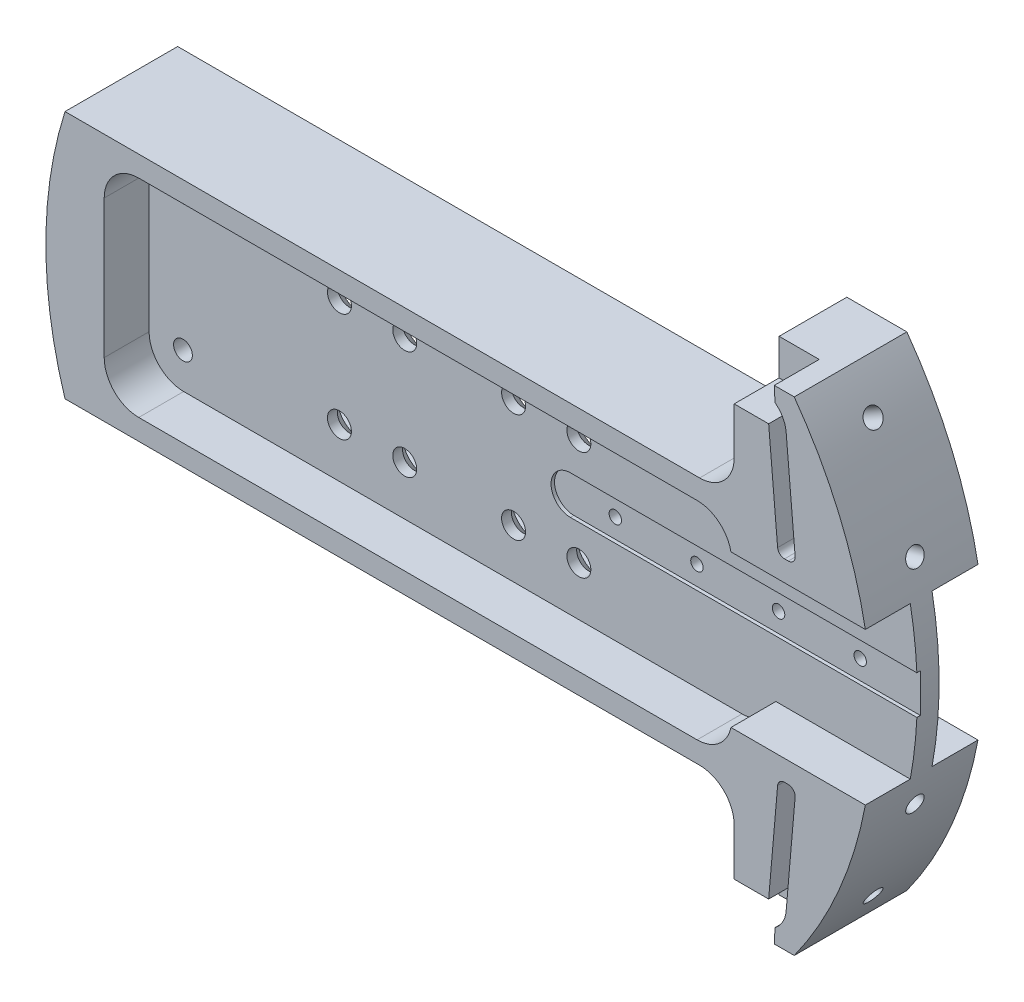
from build123d import *

# Parameters (mm, degrees)
BOSS_EXTRUDE1_DEPTH  = 2.54
BOSS_EXTRUDE2_DEPTH  = 8.255
SKETCH3_W            = 64.77
SKETCH3_H            = 7.1
CUT_EXTRUDE1_DEPTH   = 0.635
SKETCH4_R            = 1.143
CUT_EXTRUDE2_DEPTH   = 11.43
BOSS_EXTRUDE5_DEPTH  = 8.255
BOSS_EXTRUDE6_DEPTH  = 8.255
BOSS_EXTRUDE7_START  = -8.255
BOSS_EXTRUDE7_DEPTH  = 8.255
SKETCH39_W           = 13.975397925
SKETCH39_H           = 27.94
CUT_EXTRUDE19_DEPTH  = 8.255
FILLET2_R            = 1.27
SKETCH45_W           = 121.797556925
SKETCH45_H           = 2.54
BOSS_EXTRUDE8_DEPTH  = 10.795
SKETCH46_W           = 115.173424181
SKETCH46_H           = 40.351825118
CUT_EXTRUDE20_DEPTH  = 8.255
SKETCH48_W           = 115.173424181
SKETCH48_H           = 6.205912559
BOSS_EXTRUDE9_DEPTH  = 2.54
CUT_EXTRUDE24_DEPTH  = 43.688
CUT_EXTRUDE25_DEPTH  = 0.635
SKETCH53_W           = 13.339244652
SKETCH53_H           = 4.785328469
CUT_EXTRUDE26_DEPTH  = 43.688
BOSS_EXTRUDE10_REACH = 90.657
FILLET8_R            = 6.35
BOSS_EXTRUDE13_START = -20.701
BOSS_EXTRUDE13_DEPTH = 9.906
SKETCH63_R           = 1.651
CUT_EXTRUDE30_DEPTH  = 7.62
SKETCH64_R           = 1.651
CUT_EXTRUDE31_DEPTH  = 10.16
SKETCH65_R           = 1.651
CUT_EXTRUDE32_DEPTH  = 10.16
SKETCH66_R           = 1.651
CUT_EXTRUDE33_DEPTH  = 8.89
SKETCH67_R           = 1.651
CUT_EXTRUDE34_DEPTH  = 8.89
MOVE_FACE1_BY        = 1.460000128
SKETCH69_R           = 2.2
CUT_EXTRUDE35_DEPTH  = 4
CHAMFER1_SIZE        = 2.2
SKETCH70_R           = 1.725
CUT_EXTRUDE36_DEPTH  = 10


with BuildPart() as part:
    # Sketch1 → Boss-Extrude1 (new body)
    with BuildSketch(Plane.XY):
        with BuildLine():
            Line((-71.572584947, 25.4), (-65.222584947, 25.4))
            Line((-65.222584947, 25.4), (-65.222584947, 22.86))
            ThreePointArc((-65.222584947, 22.86), (-63.362713008, 18.369871939), (-58.872584947, 16.51))
            Line((-58.872584947, 16.51), (44.196, 16.51))
            ThreePointArc((44.196, 16.51), (48.686128061, 18.369871939), (50.546, 22.86))
            Line((50.546, 22.86), (50.546, 44.45))
            Line((50.546, 44.45), (61.579155694, 44.45))
            ThreePointArc((61.579155694, 44.45), (75.946, 0), (61.579155694, -44.45))
            Line((61.579155694, -44.45), (50.546, -44.45))
            Line((50.546, -44.45), (50.546, -22.86))
            ThreePointArc((50.546, -22.86), (48.686128061, -18.369871939), (44.196, -16.51))
            Line((44.196, -16.51), (-58.872584947, -16.51))
            ThreePointArc((-58.872584947, -16.51), (-63.362713008, -18.369871939), (-65.222584947, -22.86))
            Line((-65.222584947, -22.86), (-65.222584947, -25.4))
            Line((-65.222584947, -25.4), (-71.572584947, -25.4))
            ThreePointArc((-71.572584947, -25.4), (-75.946, 0), (-71.572584947, 25.4))
        make_face()
    extrude(amount=BOSS_EXTRUDE1_DEPTH)

    # Sketch2 → Boss-Extrude2 (add)
    with BuildSketch(Plane.XY.offset(2.54)):
        with BuildLine():
            Line((61.865268471, 17.78), (60.095110466, 38.1))
            ThreePointArc((60.095110466, 38.1), (59.464196764, 40.158289632), (58.047089349, 41.778911391))
            Line((58.047089349, 41.778911391), (57.900800643, 44.704))
            Line((57.900800643, 44.704), (61.395010384, 44.704))
            ThreePointArc((61.395010384, 44.704), (69.822038137, 29.877715884), (74.728381149, 13.544887112))
            Line((74.728381149, 13.544887112), (60.759450402, 13.544887112))
            Line((60.759450402, 13.544887112), (60.759450402, 15.094127876))
            ThreePointArc((60.759450402, 15.094127876), (61.639191639, 16.302501703), (61.865268471, 17.78))
        make_face()
        with BuildLine():
            Line((58.651639318, 17.500047669), (56.881481313, 37.820047669))
            Line((56.881481313, 37.820047669), (50.546, 37.820047669))
            Line((50.546, 37.820047669), (50.546, 16.566735288))
            Line((50.546, 16.566735288), (57.366094516, 16.566735288))
            ThreePointArc((57.366094516, 16.566735288), (58.160401987, 16.824667019), (58.651639318, 17.500047669))
        make_face()
        with BuildLine():
            Line((60.759450402, -13.544887112), (74.728381149, -13.544887112))
            ThreePointArc((74.728381149, -13.544887112), (69.822038137, -29.877715884), (61.395010384, -44.704))
            Line((61.395010384, -44.704), (57.900800643, -44.704))
            Line((57.900800643, -44.704), (58.047089349, -41.778911391))
            ThreePointArc((58.047089349, -41.778911391), (59.464196764, -40.158289632), (60.095110466, -38.1))
            Line((60.095110466, -38.1), (61.865268471, -17.78))
            ThreePointArc((61.865268471, -17.78), (61.639191639, -16.302501703), (60.759450402, -15.094127876))
            Line((60.759450402, -15.094127876), (60.759450402, -13.544887112))
        make_face()
        with BuildLine():
            Line((50.546, -16.566735288), (57.366094516, -16.566735288))
            ThreePointArc((57.366094516, -16.566735288), (58.160401987, -16.824667019), (58.651639318, -17.500047669))
            Line((58.651639318, -17.500047669), (56.881481313, -37.820047669))
            Line((56.881481313, -37.820047669), (50.546, -37.820047669))
            Line((50.546, -37.820047669), (50.546, -16.566735288))
        make_face()
    extrude(amount=BOSS_EXTRUDE2_DEPTH)

    # Sketch3 → Cut-Extrude1 (cut)
    with BuildSketch(Plane.XY.offset(2.54)):
        with Locations((44.577, 0)):
            Rectangle(SKETCH3_W, SKETCH3_H)
    extrude(amount=-CUT_EXTRUDE1_DEPTH, mode=Mode.SUBTRACT)

    # Sketch4 → Cut-Extrude2 (cut)
    with BuildSketch(Plane.XY.offset(1.905)):
        with Locations((19.812, 0)):
            Circle(SKETCH4_R)
        with Locations((34.812, 0)):
            Circle(SKETCH4_R)
        with Locations((49.812, 0)):
            Circle(SKETCH4_R)
        with Locations((64.812, 0)):
            Circle(SKETCH4_R)
    extrude(amount=-CUT_EXTRUDE2_DEPTH, mode=Mode.SUBTRACT)

    # Sketch19 → Boss-Extrude5 (add)
    with BuildSketch(Plane.XY.offset(2.54)):
        with BuildLine():
            Line((-71.572584947, -25.4), (-65.222584947, -25.4))
            Line((-65.222584947, -25.4), (-65.222584947, 25.4))
            Line((-65.222584947, 25.4), (-71.572584947, 25.4))
            ThreePointArc((-71.572584947, 25.4), (-75.946, 0), (-71.572584947, -25.4))
        make_face()
    extrude(amount=BOSS_EXTRUDE5_DEPTH)

    # Sketch33 → Boss-Extrude6 (add)
    with BuildSketch(Plane.XY.offset(2.54)):
        with BuildLine():
            Line((12.137284041, 16.51), (-58.872584947, 16.51))
            ThreePointArc((-58.872584947, 16.51), (-63.362713008, 18.369871939), (-65.222584947, 22.86))
            Line((-65.222584947, 22.86), (-65.222584947, 7.62))
            ThreePointArc((-65.222584947, 7.62), (-63.362713008, 12.110128061), (-58.872584947, 13.97))
            Line((-58.872584947, 13.97), (12.137284041, 13.97))
            Line((12.137284041, 13.97), (12.137284041, 16.51))
        make_face()
        with BuildLine():
            Line((12.137284041, -13.97), (12.137284041, -16.51))
            Line((12.137284041, -16.51), (-58.872584947, -16.51))
            ThreePointArc((-58.872584947, -16.51), (-63.362713008, -18.369871939), (-65.222584947, -22.86))
            Line((-65.222584947, -22.86), (-65.222584947, -7.62))
            ThreePointArc((-65.222584947, -7.62), (-63.362713008, -12.110128061), (-58.872584947, -13.97))
            Line((-58.872584947, -13.97), (12.137284041, -13.97))
        make_face()
    extrude(amount=BOSS_EXTRUDE6_DEPTH)

    # Sketch38 → Boss-Extrude7 (add)
    with BuildSketch(Plane.XY.offset(10.795).offset(BOSS_EXTRUDE7_START)):
        with BuildLine():
            Line((12.137284041, -13.97), (60.759450402, -13.97))
            Line((60.759450402, -13.97), (60.759450402, -15.094127876))
            ThreePointArc((60.759450402, -15.094127876), (61.639191639, -16.302501703), (61.865268471, -17.78))
            Line((61.865268471, -17.78), (58.298191457, -17.78))
            Line((58.298191457, -17.78), (50.546, -22.86))
            ThreePointArc((50.546, -22.86), (48.686128061, -18.369871939), (44.196, -16.51))
            Line((44.196, -16.51), (12.137284041, -16.51))
            Line((12.137284041, -16.51), (12.137284041, -13.97))
        make_face()
        with BuildLine():
            Line((61.865268471, 17.78), (58.298191457, 17.78))
            Line((58.298191457, 17.78), (50.546, 22.86))
            ThreePointArc((50.546, 22.86), (48.686128061, 18.369871939), (44.196, 16.51))
            Line((44.196, 16.51), (12.137284041, 16.51))
            Line((12.137284041, 16.51), (12.137284041, 13.97))
            Line((12.137284041, 13.97), (60.759450402, 13.97))
            Line((60.759450402, 13.97), (60.759450402, 15.094127876))
            ThreePointArc((60.759450402, 15.094127876), (61.639191639, 16.302501703), (61.865268471, 17.78))
        make_face()
    extrude(amount=BOSS_EXTRUDE7_DEPTH)

    # Sketch39 → Cut-Extrude19 (cut)
    with BuildSketch(Plane.XY.offset(10.795)):
        with Locations((67.747149365, 0)):
            Rectangle(SKETCH39_W, SKETCH39_H)
    extrude(amount=-CUT_EXTRUDE19_DEPTH, mode=Mode.SUBTRACT)

    # Fillet2
    fillet2_edges = [part.edges().sort_by_distance(p)[0] for p in [
        (58.627251529, -17.78, 6.6675),
        (58.627251529, 17.78, 6.6675),
        (61.865268471, 17.78, 6.6675),
        (61.865268471, -17.78, 6.6675),
    ]]
    fillet(fillet2_edges, radius=FILLET2_R)

    # Sketch45 → Boss-Extrude8 (add)
    with BuildSketch(Plane.XY.offset(10.795)):
        with Locations((-6.822240568, -21.445912559)):
            Rectangle(SKETCH45_W, SKETCH45_H)
        with Locations((-6.822240568, 21.445912559)):
            Rectangle(SKETCH45_W, SKETCH45_H)
    extrude(amount=-BOSS_EXTRUDE8_DEPTH)

    # Sketch46 → Cut-Extrude20 (cut)
    with BuildSketch(Plane.XY.offset(10.795)):
        with Locations((-7.635872857, 0)):
            Rectangle(SKETCH46_W, SKETCH46_H)
    extrude(amount=-CUT_EXTRUDE20_DEPTH, mode=Mode.SUBTRACT)

    # Sketch48 → Boss-Extrude9 (add)
    with BuildSketch(Plane.XY.offset(2.54)):
        with Locations((-7.635872857, 17.07295628)):
            Rectangle(SKETCH48_W, SKETCH48_H)
        with Locations((-7.635872857, -17.07295628)):
            Rectangle(SKETCH48_W, SKETCH48_H)
    extrude(amount=-BOSS_EXTRUDE9_DEPTH)

    # Sketch51 → Cut-Extrude24 (cut)
    with BuildSketch(Plane.XY.offset(10.795)):
        Polygon((-80.776388958, 25.4), (-80.776388958, 22.715912559), (-65.222584947, 22.715912559), (50.546, 22.715912559), (50.546, 25.4), (-65.222584947, 25.4), align=None)
        Polygon((50.546, -22.715912559), (-65.222584947, -22.715912559), (-80.776388958, -22.715912559), (-80.776388958, -25.4), (-65.222584947, -25.4), (50.546, -25.4), align=None)
    extrude(amount=-CUT_EXTRUDE24_DEPTH, mode=Mode.SUBTRACT)

    # Sketch52 → Cut-Extrude25 (cut)
    with BuildSketch(Plane.XY.offset(2.54)):
        with BuildLine():
            Line((12.192, -3.55), (12.192, 3.55))
            ThreePointArc((12.192, 3.55), (8.642, 0), (12.192, -3.55))
        make_face()
    extrude(amount=-CUT_EXTRUDE25_DEPTH, mode=Mode.SUBTRACT)

    # Sketch53 → Cut-Extrude26 (cut)
    with BuildSketch(Plane(origin=(0, 0, 0), x_dir=(-1, 0, 0), z_dir=(0, 0, -1))):
        with Locations((-57.215622326, -46.842664235)):
            Rectangle(SKETCH53_W, SKETCH53_H)
        with Locations((-57.215622326, 46.842664235)):
            Rectangle(SKETCH53_W, SKETCH53_H)
    extrude(amount=-CUT_EXTRUDE26_DEPTH, mode=Mode.SUBTRACT)

    # Boss-Extrude10: up to this face of the body (flat: up to its plane)
    boss_extrude10_end = Plane(part.part.faces().sort_by_distance((5.813884526, 0, 0))[0])
    # Sketch58 → Boss-Extrude10 (add, up to the picked face)
    with BuildSketch(Plane.XY.offset(10.795), mode=Mode.PRIVATE) as boss_extrude10_sk1:
        with BuildLine():
            Line((50.546, 22.86), (-72.423858748, 22.86))
            ThreePointArc((-72.423858748, 22.86), (-72.446555826, 22.787967547), (-72.469181261, 22.715912559))
            Line((-72.469181261, 22.715912559), (-65.222584947, 22.715912559))
            Line((-65.222584947, 22.715912559), (-65.222584947, 19.05))
            Line((-65.222584947, 19.05), (50.546, 19.05))
            Line((50.546, 19.05), (50.546, 22.86))
        make_face()
    boss_extrude10_tool1 = split(extrude(boss_extrude10_sk1.sketch, amount=-BOSS_EXTRUDE10_REACH, mode=Mode.PRIVATE), bisect_by=boss_extrude10_end, keep=Keep.BOTH, mode=Mode.PRIVATE)
    # Sketch58 → Boss-Extrude10 (add, up to the picked face)
    with BuildSketch(Plane.XY.offset(10.795), mode=Mode.PRIVATE) as boss_extrude10_sk2:
        with BuildLine():
            Line((-65.222584947, -22.715912559), (-65.222584947, -19.05))
            Line((-65.222584947, -19.05), (50.546, -19.05))
            Line((50.546, -19.05), (50.546, -22.86))
            Line((50.546, -22.86), (-72.423858748, -22.86))
            ThreePointArc((-72.423858748, -22.86), (-72.446555826, -22.787967547), (-72.469181261, -22.715912559))
            Line((-72.469181261, -22.715912559), (-65.222584947, -22.715912559))
        make_face()
    boss_extrude10_tool2 = split(extrude(boss_extrude10_sk2.sketch, amount=-BOSS_EXTRUDE10_REACH, mode=Mode.PRIVATE), bisect_by=boss_extrude10_end, keep=Keep.BOTH, mode=Mode.PRIVATE)
    add(boss_extrude10_tool1.solids().sort_by(Axis((-7.483073, 20.959315, 10.795), (0, 0, -1)))[0])
    add(boss_extrude10_tool2.solids().sort_by(Axis((-7.483073, -20.959315, 10.795), (0, 0, -1)))[0])

    # Fillet8
    # the kernel refuses this fillet: 6.35 mm, written as the material it adds along each edge
    with BuildSketch(Plane(origin=(50.546, 22.86, 10.795), x_dir=(-1, 0, 0), z_dir=(0, 0, -1))) as fillet8_piece_1:
        with BuildLine():
            CenterArc((FILLET8_R, FILLET8_R), FILLET8_R, 180, 90)
            Line((0, FILLET8_R), (-FILLET8_R * 0.02, FILLET8_R))
            Line((-FILLET8_R * 0.02, FILLET8_R), (-FILLET8_R * 0.02, -FILLET8_R * 0.02))
            Line((-FILLET8_R * 0.02, -FILLET8_R * 0.02), (FILLET8_R, -FILLET8_R * 0.02))
            Line((FILLET8_R, -FILLET8_R * 0.02), (FILLET8_R, 0))
        make_face()
    extrude(amount=10.795)
    with BuildSketch(Plane(origin=(50.546, -22.86, 10.795), x_dir=(-1, 0, 0), z_dir=(0, 0, -1))) as fillet8_piece_2:
        with BuildLine():
            CenterArc((FILLET8_R, -FILLET8_R), FILLET8_R, 90, 90)
            Line((0, -FILLET8_R), (-FILLET8_R * 0.02, -FILLET8_R))
            Line((-FILLET8_R * 0.02, -FILLET8_R), (-FILLET8_R * 0.02, FILLET8_R * 0.02))
            Line((-FILLET8_R * 0.02, FILLET8_R * 0.02), (FILLET8_R, FILLET8_R * 0.02))
            Line((FILLET8_R, FILLET8_R * 0.02), (FILLET8_R, 0))
        make_face()
    extrude(amount=10.795)
    with BuildSketch(Plane(origin=(49.950839234, 19.05, 2.54), x_dir=(-1, 0, 0), z_dir=(0, 0, 1))) as fillet8_piece_3:
        with BuildLine():
            CenterArc((6.221703947, 6.35), FILLET8_R, 191.536959033, 78.463040967)
            Line((0, 5.08), (-0.124434079, 5.0546))
            ThreePointArc((-0.124434079, 5.0546), (-0.127, 2.54), (-0.127, 0))
            Line((-0.127, 0), (0, -0.127))
            Line((0, -0.127), (6.221703947, -0.127))
            Line((6.221703947, -0.127), (6.221703947, 0))
        make_face()
    extrude(amount=8.255)
    with BuildSketch(Plane(origin=(49.950839234, -19.05, 2.54), x_dir=(-1.5777405628683923e-12, 1.0, 0), z_dir=(0, 0, 1))) as fillet8_piece_4:
        with BuildLine():
            CenterArc((6.35, 6.221703947), FILLET8_R, 180, 78.463040967)
            Line((0, 6.221703947), (-0.127, 6.221703947))
            Line((-0.127, 6.221703947), (-0.127, 0))
            Line((-0.127, 0), (0, -0.127))
            ThreePointArc((0, -0.127), (2.54, -0.127), (5.0546, -0.124434079))
            Line((5.0546, -0.124434079), (5.08, 0))
        make_face()
    extrude(amount=8.255)
    with BuildSketch(Plane(origin=(-65.222584947, 19.05, 10.795), x_dir=(0, -1, 0), z_dir=(0, 0, -1)), Plane(origin=(-65.222584947, -19.05, 10.795), x_dir=(1, 0, 0), z_dir=(0, 0, -1))) as fillet8_piece_5:
        with BuildLine():
            CenterArc((FILLET8_R, -FILLET8_R), FILLET8_R, 90, 90)
            Line((0, -FILLET8_R), (-FILLET8_R * 0.02, -FILLET8_R))
            Line((-FILLET8_R * 0.02, -FILLET8_R), (-FILLET8_R * 0.02, FILLET8_R * 0.02))
            Line((-FILLET8_R * 0.02, FILLET8_R * 0.02), (FILLET8_R, FILLET8_R * 0.02))
            Line((FILLET8_R, FILLET8_R * 0.02), (FILLET8_R, 0))
        make_face()
    extrude(amount=8.255)

    # Sketch59 → Boss-Extrude13 (add)
    with BuildSketch(Plane.XY.offset(10.795).offset(BOSS_EXTRUDE13_START)):
        with BuildLine():
            Line((50.546, -29.21), (50.546, -44.45))
            Line((50.546, -44.45), (61.579155694, -44.45))
            ThreePointArc((61.579155694, -44.45), (69.79870034, -29.932195824), (74.650077133, -13.97))
            Line((74.650077133, -13.97), (49.950839234, -13.97))
            ThreePointArc((49.950839234, -13.97), (47.745227916, -17.61868885), (43.729135287, -19.05))
            Line((43.729135287, -19.05), (-58.872584947, -19.05))
            ThreePointArc((-58.872584947, -19.05), (-63.362713008, -17.190128061), (-65.222584947, -12.7))
            Line((-65.222584947, -12.7), (-65.222584947, 12.7))
            ThreePointArc((-65.222584947, 12.7), (-63.362713008, 17.190128061), (-58.872584947, 19.05))
            Line((-58.872584947, 19.05), (43.729135287, 19.05))
            ThreePointArc((43.729135287, 19.05), (47.745227916, 17.61868885), (49.950839234, 13.97))
            Line((49.950839234, 13.97), (74.650077133, 13.97))
            ThreePointArc((74.650077133, 13.97), (69.79870034, 29.932195824), (61.579155694, 44.45))
            Line((61.579155694, 44.45), (50.546, 44.45))
            Line((50.546, 44.45), (50.546, 29.21))
            ThreePointArc((50.546, 29.21), (48.686128061, 24.719871939), (44.196, 22.86))
            Line((44.196, 22.86), (-72.423858748, 22.86))
            ThreePointArc((-72.423858748, 22.86), (-75.946, 0), (-72.423858748, -22.86))
            Line((-72.423858748, -22.86), (44.196, -22.86))
            ThreePointArc((44.196, -22.86), (48.686128061, -24.719871939), (50.546, -29.21))
        make_face()
    extrude(amount=BOSS_EXTRUDE13_DEPTH)

    # Sketch63 → Cut-Extrude30 (cut)
    with BuildSketch(Plane(origin=(65.771165316, 37.973, 0), x_dir=(0, 0, -1), z_dir=(0.866025403784438, 0.5000000000000012, 0))):
        with Locations(Location((-0.4445, 0.085251351, 0), (0, 0, 90))):
            Circle(SKETCH63_R)
    cut_extrude30 = extrude(amount=-CUT_EXTRUDE30_DEPTH, mode=Mode.SUBTRACT)

    # Sketch64 → Cut-Extrude31 (cut)
    with BuildSketch(Plane(origin=(73.358202803, 19.656271199, 0), x_dir=(0, 0, -1), z_dir=(0.9659258262890681, 0.2588190451025213, 0))):
        with Locations(Location((-0.381, 0.015122113, 0), (0, 0, 90))):
            Circle(SKETCH64_R)
    cut_extrude31 = extrude(amount=-CUT_EXTRUDE31_DEPTH, mode=Mode.SUBTRACT)

    # Mirror1: Cut-Extrude30, Cut-Extrude31 across plane
    add(cut_extrude30.mirror(Plane.ZX), mode=Mode.SUBTRACT)
    add(cut_extrude31.mirror(Plane.ZX), mode=Mode.SUBTRACT)

    # Sketch65 → Cut-Extrude32 (cut)
    with BuildSketch(Plane.ZY.offset(75.946)):
        with Locations((0.508, 0)):
            Circle(SKETCH65_R)
    extrude(amount=-CUT_EXTRUDE32_DEPTH, mode=Mode.SUBTRACT)

    # Sketch66 → Cut-Extrude33 (cut)
    with BuildSketch(Plane(origin=(-73.358202803, -19.656271199, 0), x_dir=(0, 0, 1), z_dir=(-0.9659258262890681, -0.2588190451025213, 0))):
        with Locations(Location((0.508, -0.034390425, 0), (0, 0, 270))):
            Circle(SKETCH66_R)
    extrude(amount=-CUT_EXTRUDE33_DEPTH, mode=Mode.SUBTRACT)

    # Sketch67 → Cut-Extrude34 (cut)
    with BuildSketch(Plane(origin=(-73.358202803, 19.656271199, 0), x_dir=(0, 0, 1), z_dir=(-0.9659258262890681, 0.2588190451025213, 0))):
        with Locations(Location((0.508, 0, 0), (0, 0, 270))):
            Circle(SKETCH67_R)
    extrude(amount=-CUT_EXTRUDE34_DEPTH, mode=Mode.SUBTRACT)

    # Move Face1: a face moved outward by 1.46
    extrude(part.faces().sort_by_distance((2.165536363, 0, 0))[0], amount=MOVE_FACE1_BY, dir=(0, 0, -1))

    # Sketch69 → Cut-Extrude35 (cut)
    with BuildSketch(Plane(origin=(0, 0, -1.460000128), x_dir=(-1, 0, 0), z_dir=(0, 0, -1))):
        with Locations((30.249199922, -10.000000099)):
            Circle(SKETCH69_R)
        with Locations((30.249199922, 9.999999901)):
            Circle(SKETCH69_R)
        with Locations((-13.750800078, -10.000000099)):
            Circle(SKETCH69_R)
        with Locations((-13.750800078, 9.999999901)):
            Circle(SKETCH69_R)
        with Locations((-1.750800078, -10.000000099)):
            Circle(SKETCH69_R)
        with Locations((-1.750800078, 9.999999901)):
            Circle(SKETCH69_R)
        with Locations((18.249199922, -10.000000099)):
            Circle(SKETCH69_R)
        with Locations((18.249199922, 9.999999901)):
            Circle(SKETCH69_R)
    extrude(amount=-CUT_EXTRUDE35_DEPTH, mode=Mode.SUBTRACT)

    # Chamfer1
    chamfer1_edges = [part.edges().sort_by_distance(p)[0] for p in [
        (-28.049199922, -10.000000099, -1.460000128),
        (-16.049199922, 9.999999901, -1.460000128),
        (-16.049199922, -10.000000099, -1.460000128),
        (3.950800078, 9.999999901, -1.460000128),
        (3.950800078, -10.000000099, -1.460000128),
        (15.950800078, 9.999999901, -1.460000128),
        (15.950800078, -10.000000099, -1.460000128),
        (-28.049199922, 9.999999901, -1.460000128),
    ]]
    chamfer(chamfer1_edges, length=CHAMFER1_SIZE)

    # Sketch70 → Cut-Extrude36 (cut)
    with BuildSketch(Plane.XY.offset(2.54)):
        with Locations((-59.002584947, -12.5)):
            Circle(SKETCH70_R)
        with Locations((-59.002584947, 12.5)):
            Circle(SKETCH70_R)
    extrude(amount=-CUT_EXTRUDE36_DEPTH, mode=Mode.SUBTRACT)


solid = part.part
